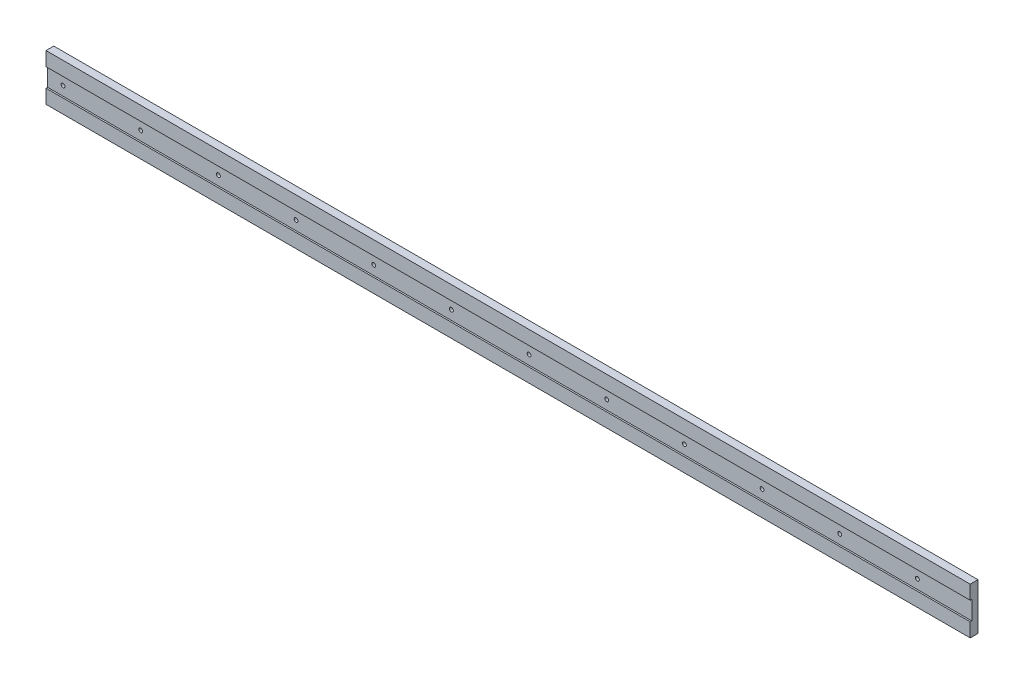
from build123d import *

# Parameters (mm, degrees)
SKETCH_1_W             = 595
SKETCH_1_H             = 30
EXTRUDE_1_DEPTH        = 5
HOLE_WIZARD_M3_1_D     = 2.5
PATTERN_LINEAR_1_COUNT = 12
PATTERN_LINEAR_1_PITCH = 50
SKETCH_4_W             = 595
SKETCH_4_H             = 12
CUT_EXTRUDE_1_DEPTH    = 1


with BuildPart() as part:
    # 草图1 → 凸台-拉伸1 (new body)
    with BuildSketch(Plane.XY):
        with Locations((297.5, 15)):
            Rectangle(SKETCH_1_W, SKETCH_1_H)
    extrude(amount=EXTRUDE_1_DEPTH)

    # M3 螺纹孔1 (through all)
    with Locations(Plane.XY.offset(5)):
        with Locations((10, 15)):
            hole_wizard_m3_1 = Hole(HOLE_WIZARD_M3_1_D / 2)

    # 阵列(线性)1: M3 螺纹孔1 ×12
    with Locations(*[(i * PATTERN_LINEAR_1_PITCH, 0, 0) for i in range(1, PATTERN_LINEAR_1_COUNT)]):
        add(hole_wizard_m3_1, mode=Mode.SUBTRACT)

    # 草图4 → 切除-拉伸1 (cut)
    with BuildSketch(Plane.XY.offset(5)):
        with Locations((297.5, 15)):
            Rectangle(SKETCH_4_W, SKETCH_4_H)
    extrude(amount=-CUT_EXTRUDE_1_DEPTH, mode=Mode.SUBTRACT)


solid = part.part
